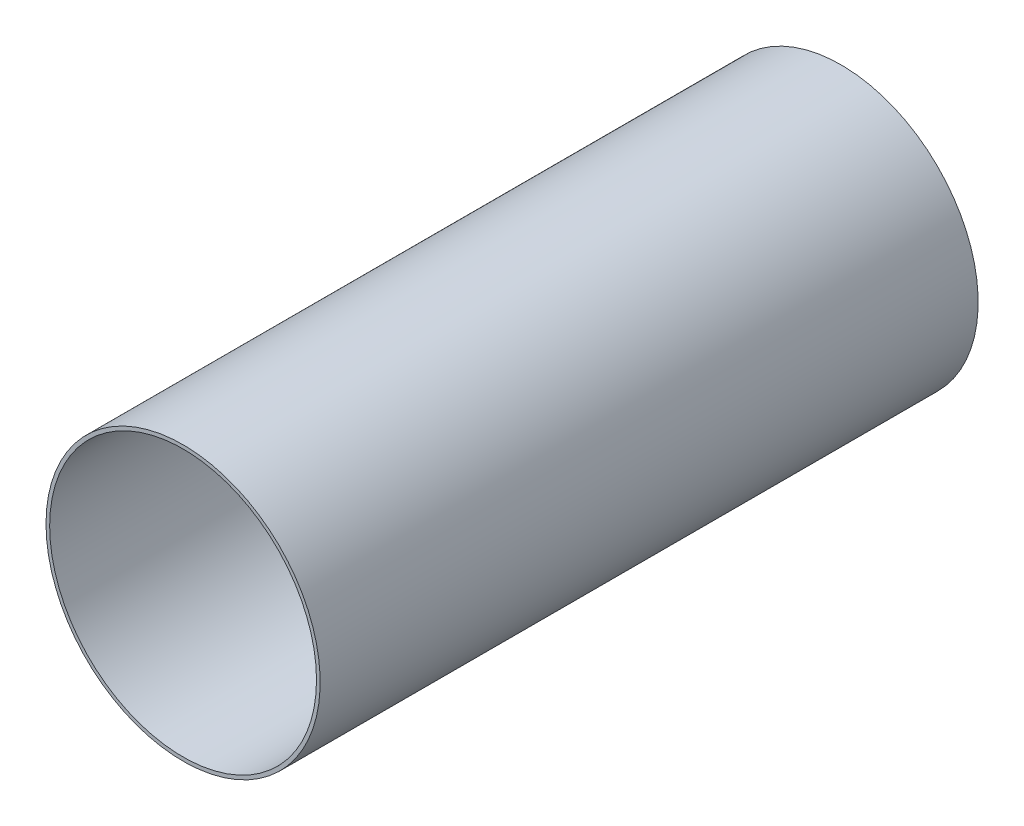
from build123d import *

# Parameters (mm, degrees)
SCHIZZO1_R                = 75
SCHIZZO1_R_2              = 73
ESTRUSIONE_SOTTILE1_DEPTH = 360


with BuildPart() as part:
    # Schizzo1 → Estrusione-Sottile1 (new body)
    with BuildSketch(Plane.XY):
        Circle(SCHIZZO1_R)
        Circle(SCHIZZO1_R_2, mode=Mode.SUBTRACT)
    extrude(amount=ESTRUSIONE_SOTTILE1_DEPTH)


solid = part.part
